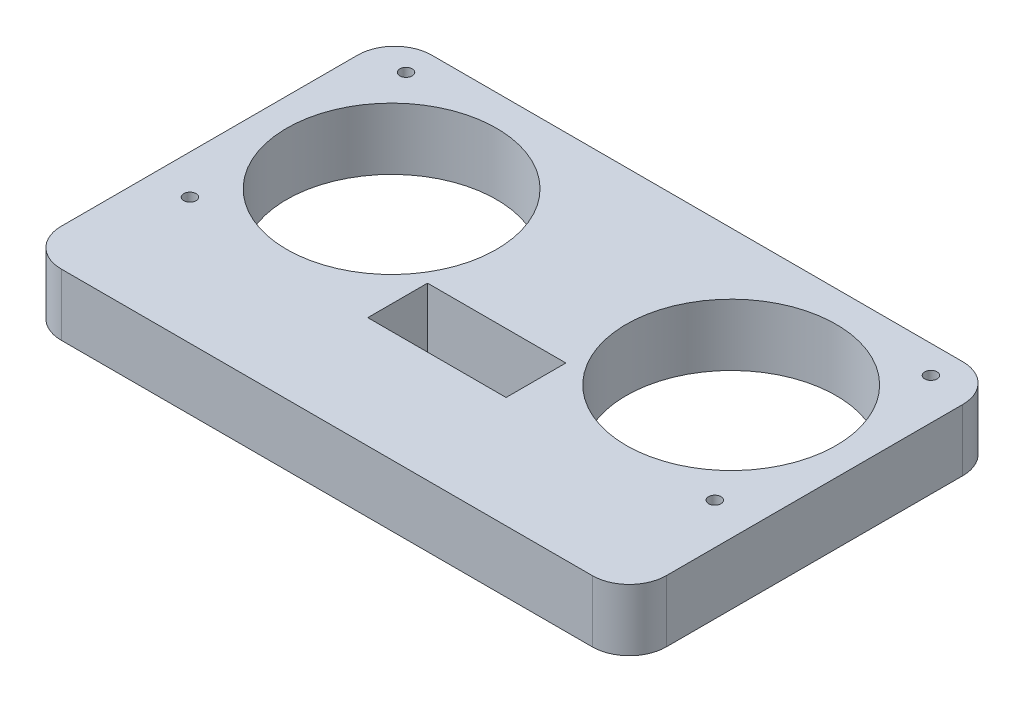
from build123d import *

# Parameters (mm, degrees)
SKETCH1_R           = 21
SKETCH1_R_2         = 20
BOSS_EXTRUDE1_DEPTH = 3.5
SKETCH2_R           = 3.55
SKETCH2_R_2         = 6.55
SKETCH2_R_3         = 2.55
SKETCH2_R_4         = 8.5
SKETCH2_W           = 11.2
SKETCH2_H           = 4.84
BOSS_EXTRUDE2_DEPTH = 5
SKETCH3_W           = 11.2
SKETCH3_H           = 4.84
SKETCH3_W_2         = 49
SKETCH3_H_2         = 8
SKETCH3_R           = 8.5
IGNORE_DEPTH        = 5
SKETCH4_W           = 11.2
SKETCH4_H           = 4.84
SKETCH4_R           = 8.5
CUT_EXTRUDE2_DEPTH  = 71.901339903
FILLET1_R           = 3
SKETCH5_W           = 42
SKETCH5_H           = 3.5
CUT_EXTRUDE3_DEPTH  = 25
CUT_EXTRUDE5_DEPTH  = 10
FILLET2_R           = 3
SKETCH8_R           = 0.5
CUT_EXTRUDE6_DEPTH  = 20


with BuildPart() as part:
    # Sketch1 → Boss-Extrude1 (new body)
    with BuildSketch(Plane(origin=(0, 0, 0), x_dir=(1, 0, 0), z_dir=(0, 1, 0))):
        Circle(SKETCH1_R)
        Circle(SKETCH1_R_2, mode=Mode.SUBTRACT)
    extrude(amount=BOSS_EXTRUDE1_DEPTH)

    # Sketch2 → Boss-Extrude2 (add)
    with BuildSketch(Plane(origin=(0, 3.5, 0), x_dir=(1, 0, 0), z_dir=(0, 1, 0))):
        Polygon((-29, -5), (-29, -29), (29, -29), (29, -5), (39, -5), (39, 5), (29, 5), (29, 29), (24.5, 29), (24.5, 51), (-24.5, 51), (-24.5, 29), (-29, 29), (-29, 5), (-39, 5), (-39, -5), align=None)
        with Locations((-23.55, -23.55)):
            Circle(SKETCH2_R, mode=Mode.SUBTRACT)
        with Locations((23.55, -23.55)):
            Circle(SKETCH2_R, mode=Mode.SUBTRACT)
        Circle(SKETCH2_R_2, mode=Mode.SUBTRACT)
        with Locations((-23.55, 23.55)):
            Circle(SKETCH2_R, mode=Mode.SUBTRACT)
        with Locations((23.55, 23.55)):
            Circle(SKETCH2_R, mode=Mode.SUBTRACT)
        with Locations((-34, 0)):
            Circle(SKETCH2_R_3, mode=Mode.SUBTRACT)
        with Locations((13.76, 39)):
            Circle(SKETCH2_R_4, mode=Mode.SUBTRACT)
        with Locations((-13.76, 39)):
            Circle(SKETCH2_R_4, mode=Mode.SUBTRACT)
        with Locations((0, 46.28)):
            Rectangle(SKETCH2_W, SKETCH2_H, mode=Mode.SUBTRACT)
        with Locations((34, 0)):
            Circle(SKETCH2_R_3, mode=Mode.SUBTRACT)
    extrude(amount=BOSS_EXTRUDE2_DEPTH)

    # Sketch3 → Ignore (add)
    with BuildSketch(Plane(origin=(0, 3.5, 0), x_dir=(1, 0, 0), z_dir=(0, 1, 0))):
        with Locations((0, 46.28)):
            Rectangle(SKETCH3_W, SKETCH3_H)
        with Locations((0, 55)):
            Rectangle(SKETCH3_W_2, SKETCH3_H_2)
        with Locations((-13.76, 39)):
            Circle(SKETCH3_R)
        with Locations((13.76, 39)):
            Circle(SKETCH3_R)
    extrude(amount=IGNORE_DEPTH)

    # Sketch4 → Cut-Extrude2 (cut, through all)
    with BuildSketch(Plane(origin=(0, 3.5, 0), x_dir=(1, 0, 0), z_dir=(0, 1, 0))):
        with Locations((-0.079148889, 40.42)):
            Rectangle(SKETCH4_W, SKETCH4_H)
        with Locations((-13.75, 48)):
            Circle(SKETCH4_R)
        with Locations((13.75, 48)):
            Circle(SKETCH4_R)
    extrude(amount=CUT_EXTRUDE2_DEPTH, mode=Mode.SUBTRACT)

    # Fillet1
    fillet1_edges = [part.edges().sort_by_distance(p)[0] for p in [
        (29, 6, -29),
        (39, 6, 5),
        (39, 6, -5),
        (29, 6, 29),
        (-29, 6, 29),
        (-39, 6, 5),
        (-39, 6, -5),
        (-29, 6, -29),
        (24.5, 6, -59),
        (-24.5, 6, -59),
    ]]
    fillet(fillet1_edges, radius=FILLET1_R)

    # Sketch5 → Cut-Extrude3 (cut, symmetric)
    with BuildSketch(Plane.XY):
        with Locations((0, 1.75)):
            Rectangle(SKETCH5_W, SKETCH5_H)
    extrude(amount=CUT_EXTRUDE3_DEPTH, both=True, mode=Mode.SUBTRACT)

    # Sketch6 → Cut-Extrude5 (cut)
    with BuildSketch(Plane(origin=(0, 8.5, 0), x_dir=(1, 0, 0), z_dir=(0, 1, 0))):
        Polygon((-26, 29), (24.5, 29), (43.321910497, 29), (43.321910497, -33.14300085), (-52.072842779, -33.14300085), (-52.072842779, 29), (-38.2971121, 29), align=None)
    extrude(amount=-CUT_EXTRUDE5_DEPTH, mode=Mode.SUBTRACT)

    # Fillet2
    fillet2_edges = [part.edges().sort_by_distance(p)[0] for p in [
        (24.5, 6, -29),
        (-24.5, 6, -29),
    ]]
    fillet(fillet2_edges, radius=FILLET2_R)

    # Sketch8 → Cut-Extrude6 (cut)
    with BuildSketch(Plane.XZ.offset(-3.5)):
        with Locations((21.170851111, -39.25)):
            Circle(SKETCH8_R)
        with Locations((21.170851111, -56.75)):
            Circle(SKETCH8_R)
        with Locations((-21.329148889, -56.75)):
            Circle(SKETCH8_R)
        with Locations((-21.329148889, -39.25)):
            Circle(SKETCH8_R)
    extrude(amount=-CUT_EXTRUDE6_DEPTH, mode=Mode.SUBTRACT)


solid = part.part
